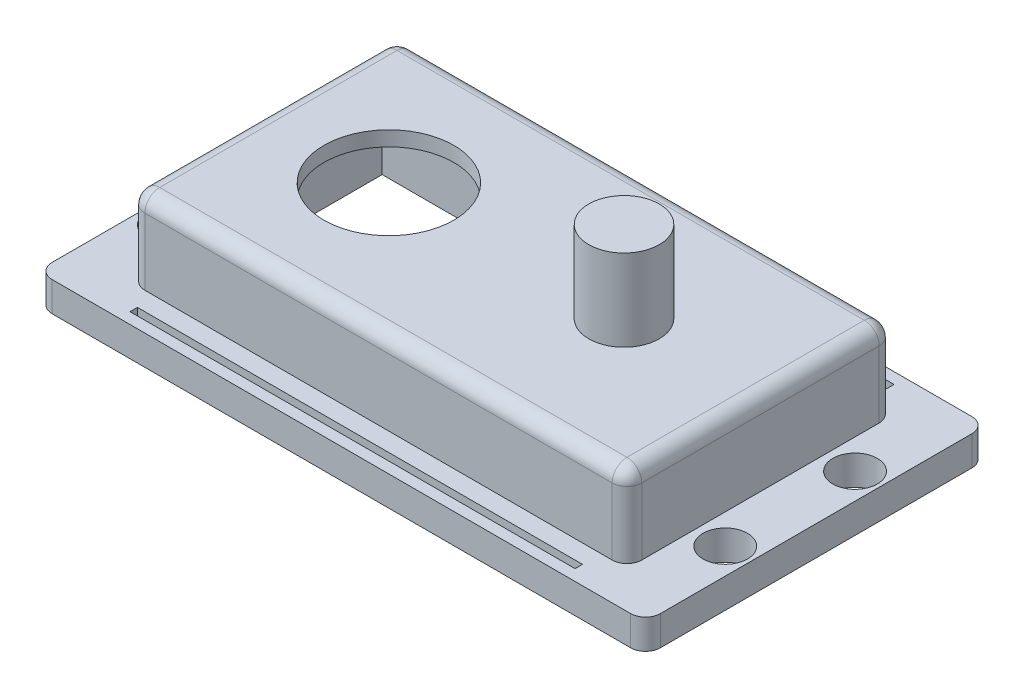
from build123d import *

# Parameters (mm, degrees)
ESQUISSE1_W             = 82
ESQUISSE1_H             = 46
ESQUISSE1_R             = 3
BOSS_EXTRU_1_DEPTH      = 15
ESQUISSE2_W             = 66
ESQUISSE2_H             = 31
ENL_V_MAT_EXTRU_1_DEPTH = 13
ENL_V_START             = 15
ESQUISSE3_R             = 8.75
ENL_V_MAT_EXTRU_2_DEPTH = 65.345719166
ESQUISSE4_W             = 67
ESQUISSE4_H             = 36
ENL_V_MAT_EXTRU_3_DEPTH = 11
BOSS_EXTRU_3_START      = 15
ESQUISSE5_R             = 4.75
BOSS_EXTRU_3_DEPTH      = 11
ENL_V_START_2           = 4
ESQUISSE1_4_W           = 60
ESQUISSE1_4_H           = 1
ENL_V_MAT_EXTRU_4_DEPTH = 1
CONG_1_R                = 2
CONG_2_R                = 2
CONG_4_R                = 2


with BuildPart() as part:
    # Esquisse1 → Boss.-Extru.1 (new body)
    with BuildSketch(Plane(origin=(0, 0, 0), x_dir=(1, 0, 0), z_dir=(0, 1, 0))):
        Rectangle(ESQUISSE1_W, ESQUISSE1_H)
        with Locations(Location((-37.5, 8.75, 0), (0, 0, 270))):
            Circle(ESQUISSE1_R, mode=Mode.SUBTRACT)
        with Locations(Location((37.5, 8.75, 0), (0, 0, 270))):
            Circle(ESQUISSE1_R, mode=Mode.SUBTRACT)
        with Locations(Location((37.5, -8.75, 0), (0, 0, 270))):
            Circle(ESQUISSE1_R, mode=Mode.SUBTRACT)
        with Locations(Location((-37.5, -8.75, 0), (0, 0, 270))):
            Circle(ESQUISSE1_R, mode=Mode.SUBTRACT)
    extrude(amount=BOSS_EXTRU_1_DEPTH)

    # Esquisse2 → Enlèv. mat.-Extru.1 (cut)
    with BuildSketch(Plane(origin=(0, 0, 0), x_dir=(1, 0, 0), z_dir=(0, 1, 0))):
        Rectangle(ESQUISSE2_W, ESQUISSE2_H)
    extrude(amount=ENL_V_MAT_EXTRU_1_DEPTH, mode=Mode.SUBTRACT)

    # Esquisse3 → Enlèv. mat.-Extru.2 (cut, through all)
    with BuildSketch(Plane(origin=(0, 0, 0), x_dir=(1, 0, 0), z_dir=(0, 1, 0)).offset(ENL_V_START)):
        with Locations(Location((-16.6, 0, 0), (0, 0, 270))):
            Circle(ESQUISSE3_R)
    extrude(amount=-ENL_V_MAT_EXTRU_2_DEPTH, mode=Mode.SUBTRACT)

    # Esquisse4 → Enlèv. mat.-Extru.3 (cut)
    with BuildSketch(Plane(origin=(0, 0, 0), x_dir=(1, 0, 0), z_dir=(0, 1, 0)).offset(ENL_V_START)):
        Polygon((-33.5, -23), (-41, -23), (-41, 23), (-33.5, 23), (33.5, 23), (41, 23), (41, -23), (33.5, -23), align=None)
        Rectangle(ESQUISSE4_W, ESQUISSE4_H, mode=Mode.SUBTRACT)
    extrude(amount=-ENL_V_MAT_EXTRU_3_DEPTH, mode=Mode.SUBTRACT)

    # Esquisse5 → Boss.-Extru.3 (add)
    with BuildSketch(Plane(origin=(0, 0, 0), x_dir=(1, 0, 0), z_dir=(0, 1, 0)).offset(BOSS_EXTRU_3_START)):
        with Locations(Location((15.1, 0, 0), (0, 0, 270))):
            Circle(ESQUISSE5_R)
    extrude(amount=BOSS_EXTRU_3_DEPTH)

    # Esquisse1<4> → Enlèv. mat.-Extru.4 (cut)
    with BuildSketch(Plane(origin=(0, 0, 0), x_dir=(1, 0, 0), z_dir=(0, 1, 0)).offset(ENL_V_START_2)):
        with Locations((0, -21)):
            Rectangle(ESQUISSE1_4_W, ESQUISSE1_4_H)
        with Locations((0, 21)):
            Rectangle(ESQUISSE1_4_W, ESQUISSE1_4_H)
    extrude(amount=-ENL_V_MAT_EXTRU_4_DEPTH, mode=Mode.SUBTRACT)

    # Congé1
    cong_1_edges = [part.edges().sort_by_distance(p)[0] for p in [
        (0, 15, 18),
        (-33.5, 15, 0),
        (0, 15, -18),
        (33.5, 15, 0),
    ]]
    fillet(cong_1_edges, radius=CONG_1_R)

    # Congé2
    # the kernel refuses this fillet: 2 mm, written as the material it takes off along each edge
    with BuildSketch(Plane(origin=(-31.5, 13, -16), x_dir=(0, 0, -1), z_dir=(-1, 0, 0))) as cong_2_piece_1_section:
        Polygon((0, 0), (CONG_2_R, 0), (CONG_2_R, -CONG_2_R), (0, -CONG_2_R), align=None)
    cong_2_piece_1 = extrude(amount=CONG_2_R, mode=Mode.PRIVATE)
    cong_2_piece_1 = cong_2_piece_1 - Plane(origin=(-31.5, 13, -16), x_dir=(0, -0.7071067811865475, 0.7071067811865475), z_dir=(-1, 0, 0)) * Sphere(CONG_2_R, mode=Mode.PRIVATE)
    add(cong_2_piece_1, mode=Mode.SUBTRACT)
    with BuildSketch(Plane(origin=(-31.5, 13, 16), x_dir=(-1, 0, 0), z_dir=(0, 0, 1))) as cong_2_piece_2_section:
        Polygon((0, 0), (CONG_2_R, 0), (CONG_2_R, -CONG_2_R), (0, -CONG_2_R), align=None)
    cong_2_piece_2 = extrude(amount=CONG_2_R, mode=Mode.PRIVATE)
    cong_2_piece_2 = cong_2_piece_2 - Plane(origin=(-31.5, 13, 16), x_dir=(0.7071067811865475, -0.7071067811865475, 0), z_dir=(0, 0, 1)) * Sphere(CONG_2_R, mode=Mode.PRIVATE)
    add(cong_2_piece_2, mode=Mode.SUBTRACT)
    with BuildSketch(Plane(origin=(31.5, 13, -16), x_dir=(0, 0, -1), z_dir=(1, 0, 0))) as cong_2_piece_3_section:
        Polygon((0, 0), (CONG_2_R, 0), (CONG_2_R, CONG_2_R), (0, CONG_2_R), align=None)
    cong_2_piece_3 = extrude(amount=CONG_2_R, mode=Mode.PRIVATE)
    cong_2_piece_3 = cong_2_piece_3 - Plane(origin=(31.5, 13, -16), x_dir=(0, -0.7071067811865475, 0.7071067811865475), z_dir=(1, 0, 0)) * Sphere(CONG_2_R, mode=Mode.PRIVATE)
    add(cong_2_piece_3, mode=Mode.SUBTRACT)
    with BuildSketch(Plane(origin=(31.5, 13, 16), x_dir=(1, 0, 0), z_dir=(0, 0, 1))) as cong_2_piece_4_section:
        Polygon((0, 0), (CONG_2_R, 0), (CONG_2_R, CONG_2_R), (0, CONG_2_R), align=None)
    cong_2_piece_4 = extrude(amount=CONG_2_R, mode=Mode.PRIVATE)
    cong_2_piece_4 = cong_2_piece_4 - Plane(origin=(31.5, 13, 16), x_dir=(-0.7071067811865475, -0.7071067811865475, 0), z_dir=(0, 0, 1)) * Sphere(CONG_2_R, mode=Mode.PRIVATE)
    add(cong_2_piece_4, mode=Mode.SUBTRACT)
    with BuildSketch(Plane(origin=(-33.5, 13, 18), x_dir=(1, 0, 0), z_dir=(0, -1, 0)), Plane(origin=(-33.5, 13, -18), x_dir=(0, 0, 1), z_dir=(0, -1, 0))) as cong_2_piece_5:
        with BuildLine():
            CenterArc((CONG_2_R, -CONG_2_R), CONG_2_R, 90, 90)
            Line((0, -CONG_2_R), (0, 0))
            Line((0, 0), (CONG_2_R, 0))
        make_face()
    extrude(amount=9, mode=Mode.SUBTRACT)
    with BuildSketch(Plane(origin=(33.5, 13, -18), x_dir=(0, 0, 1), z_dir=(0, -1, 0)), Plane(origin=(33.5, 13, 18), x_dir=(-1, 0, 0), z_dir=(0, -1, 0))) as cong_2_piece_6:
        with BuildLine():
            CenterArc((CONG_2_R, CONG_2_R), CONG_2_R, 180, 90)
            Line((0, CONG_2_R), (0, 0))
            Line((0, 0), (CONG_2_R, 0))
        make_face()
    extrude(amount=9, mode=Mode.SUBTRACT)

    # Congé4
    cong_4_edges = [part.edges().sort_by_distance(p)[0] for p in [
        (41, 2, 23),
        (-41, 2, 23),
        (-41, 2, -23),
        (41, 2, -23),
    ]]
    fillet(cong_4_edges, radius=CONG_4_R)


solid = part.part
